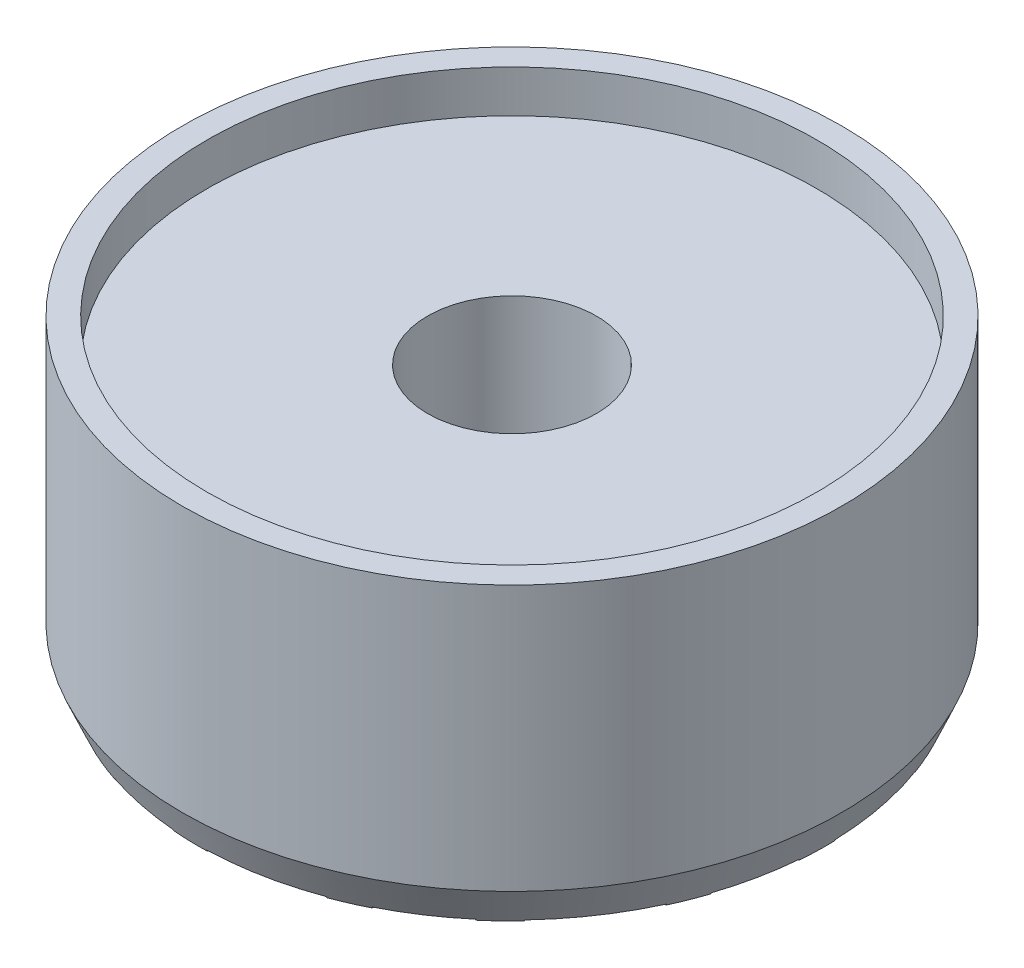
from build123d import *

# Parameters (mm, degrees)
SKETCH1_R                    = 99.06
BOSS_EXTRUDE1_DEPTH          = 88.9
SKETCH2_R                    = 25.4
CUT_EXTRUDE1_DEPTH           = 76.2
SKETCH3_R                    = 91.687559662
CUT_EXTRUDE2_DEPTH           = 12.7
CUT_EXTRUDE3_START           = 50.8
SKETCH5_R                    = 25.4
CUT_EXTRUDE3_DEPTH           = 50.8
CUT_EXTRUDE4_DEPTH           = 50.8
CUT_EXTRUDE4_DRAFT           = 3
CUT_EXTRUDE4_PROFILE_2_DEPTH = 50.8
CUT_EXTRUDE4_PROFILE_2_DRAFT = 3
CUT_EXTRUDE4_PROFILE_3_DEPTH = 50.8
CUT_EXTRUDE4_PROFILE_3_DRAFT = 3
CUT_EXTRUDE4_PROFILE_4_DEPTH = 50.8
CUT_EXTRUDE4_PROFILE_4_DRAFT = 3
CUT_EXTRUDE4_PROFILE_5_DEPTH = 50.8
CUT_EXTRUDE4_PROFILE_5_DRAFT = 3
CUT_EXTRUDE4_PROFILE_6_DEPTH = 50.8
CUT_EXTRUDE4_PROFILE_6_DRAFT = 3
CUT_EXTRUDE4_PROFILE_7_DEPTH = 50.8
CUT_EXTRUDE4_PROFILE_7_DRAFT = 3
CUT_EXTRUDE4_PROFILE_8_DEPTH = 50.8
CUT_EXTRUDE4_PROFILE_8_DRAFT = 3
CUT_EXTRUDE4_PROFILE_9_DEPTH = 50.8
CUT_EXTRUDE4_PROFILE_9_DRAFT = 3
SKETCH8_R                    = 25.4
BOSS_EXTRUDE2_DEPTH          = 30.48
SKETCH9_R                    = 22.86
CUT_EXTRUDE5_DEPTH           = 30.48
CHAMFER1_SIZE                = 9.131629152
CHAMFER1_SIZE_2              = 5.08


with BuildPart() as part:
    # Sketch1 → Boss-Extrude1 (new body)
    with BuildSketch(Plane(origin=(0, 0, 0), x_dir=(1, 0, 0), z_dir=(0, 1, 0))):
        with Locations(Location((0, 0, 0), (0, 0, 270))):
            Circle(SKETCH1_R)
    extrude(amount=BOSS_EXTRUDE1_DEPTH)

    # Sketch2 → Cut-Extrude1 (cut)
    with BuildSketch(Plane(origin=(0, 88.9, 0), x_dir=(1, 0, 0), z_dir=(0, 1, 0))):
        with Locations(Location((0, 0, 0), (0, 0, 270))):
            Circle(SKETCH2_R)
    extrude(amount=-CUT_EXTRUDE1_DEPTH, mode=Mode.SUBTRACT)

    # Sketch3 → Cut-Extrude2 (cut)
    with BuildSketch(Plane(origin=(0, 88.9, 0), x_dir=(1, 0, 0), z_dir=(0, 1, 0))):
        with Locations(Location((0, 0, 0), (0, 0, 270))):
            Circle(SKETCH3_R)
    extrude(amount=-CUT_EXTRUDE2_DEPTH, mode=Mode.SUBTRACT)

    # Sketch4 → Revolve1 (revolve)
    with BuildSketch(Plane.XY, mode=Mode.PRIVATE) as revolve1_sk:
        Polygon((0, 0), (0, -39.692768961), (99.06, 0), align=None)
    revolve(revolve1_sk.sketch.rotate(Axis((0, 0, 0), (0, -1, 0)), 90), axis=Axis((0, 0, 0), (0, -1, 0)))

    # Sketch5 → Cut-Extrude3 (cut)
    with BuildSketch(Plane(origin=(0, -52.324, 0), x_dir=(1, 0, 0), z_dir=(0, 1, 0)).offset(CUT_EXTRUDE3_START)):
        with Locations(Location((0, 0, 0), (0, 0, 270))):
            Circle(SKETCH5_R)
    extrude(amount=-CUT_EXTRUDE3_DEPTH, mode=Mode.SUBTRACT)


with BuildPart() as cut_extrude4_tool:
    # Sketch6 → Cut-Extrude4 (with draft: the straight prism first)
    with BuildSketch(Plane(origin=(0, -52.324, 0), x_dir=(1, 0, 0), z_dir=(0, 1, 0))):
        with BuildLine():
            Line((-5.08, -98.929657838), (-5.08, -24.886815787))
            Line((-5.08, -24.886815787), (-34.098749141, -93.006230474))
            ThreePointArc((-34.098749141, -93.006230474), (-19.812, -97.058581568), (-5.08, -98.929657838))
        make_face()
    extrude(amount=CUT_EXTRUDE4_DEPTH)
    # Cut-Extrude4: the draft: its side faces are tilted about the plane it starts from
    cut_extrude4_sides = [cut_extrude4_tool.faces().sort_by_distance(p)[0] for p in [
        (-5.08, -26.924, 61.908236812),
        (-19.589374571, -26.924, 58.94652313),
        (-19.812, -26.924, 97.058581568),
    ]]
    draft(cut_extrude4_sides, Plane(origin=(0, -52.324, 0), x_dir=(1, 0, 0), z_dir=(0, 1, 0)), CUT_EXTRUDE4_DRAFT)


with BuildPart() as part_1:
    add(part.part)

    # Cut-Extrude4: cut by cut_extrude4_tool
    add(cut_extrude4_tool.part, mode=Mode.SUBTRACT)


with BuildPart() as cut_extrude4_profile_2_tool:
    # Sketch6 → Cut-Extrude4 profile 2 (with draft: the straight prism first)
    with BuildSketch(Plane(origin=(0, -52.324, 0), x_dir=(1, 0, 0), z_dir=(0, 1, 0))):
        with BuildLine():
            ThreePointArc((-5.08, -24.886815787), (-2.552927635, -25.271378286), (0, -25.4))
            Line((0, -25.4), (0, -99.06))
            ThreePointArc((0, -99.06), (18.833477542, -97.2531939), (36.97992819, -91.898686123))
            Line((36.97992819, -91.898686123), (23.711541952, -58.906814361))
            Line((23.711541952, -58.906814361), (9.484616781, -23.562725745))
            ThreePointArc((9.484616781, -23.562725745), (11.804853239, -22.490118719), (14.005533756, -21.189738653))
            ThreePointArc((14.005533756, -21.189738653), (16.064370514, -19.674755399), (17.960512242, -17.960512242))
            Line((17.960512242, -17.960512242), (70.045997744, -70.045997744))
            ThreePointArc((70.045997744, -70.045997744), (82.085672582, -55.451113215), (91.13094213, -38.833426149))
            Line((91.13094213, -38.833426149), (58.42, -24.886815787))
            Line((58.42, -24.886815787), (23.368, -9.954726315))
            ThreePointArc((23.368, -9.954726315), (24.250207232, -7.55562368), (24.886815787, -5.08))
            ThreePointArc((24.886815787, -5.08), (25.271378286, -2.552927635), (25.4, 0))
            Line((25.4, 0), (99.06, 0))
            ThreePointArc((99.06, 0), (97.2531939, 18.833477542), (91.898686123, 36.97992819))
            Line((91.898686123, 36.97992819), (58.906814361, 23.711541952))
            Line((58.906814361, 23.711541952), (23.562725745, 9.484616781))
            ThreePointArc((23.562725745, 9.484616781), (22.490118719, 11.804853239), (21.189738653, 14.005533756))
            ThreePointArc((21.189738653, 14.005533756), (19.674755399, 16.064370514), (17.960512242, 17.960512242))
            Line((17.960512242, 17.960512242), (70.045997744, 70.045997744))
            ThreePointArc((70.045997744, 70.045997744), (55.451113215, 82.085672582), (38.833426149, 91.13094213))
            Line((38.833426149, 91.13094213), (24.886815787, 58.42))
            Line((24.886815787, 58.42), (9.954726315, 23.368))
            ThreePointArc((9.954726315, 23.368), (7.55562368, 24.250207232), (5.08, 24.886815787))
            ThreePointArc((5.08, 24.886815787), (2.552927635, 25.271378286), (0, 25.4))
            Line((0, 25.4), (0, 99.06))
            ThreePointArc((0, 99.06), (-18.833477542, 97.2531939), (-36.97992819, 91.898686123))
            Line((-36.97992819, 91.898686123), (-23.711541952, 58.906814361))
            Line((-23.711541952, 58.906814361), (-9.484616781, 23.562725745))
            ThreePointArc((-9.484616781, 23.562725745), (-11.804853239, 22.490118719), (-14.005533756, 21.189738653))
            ThreePointArc((-14.005533756, 21.189738653), (-16.064370514, 19.674755399), (-17.960512242, 17.960512242))
            Line((-17.960512242, 17.960512242), (-70.045997744, 70.045997744))
            ThreePointArc((-70.045997744, 70.045997744), (-82.085672582, 55.451113215), (-91.13094213, 38.833426149))
            Line((-91.13094213, 38.833426149), (-58.42, 24.886815787))
            Line((-58.42, 24.886815787), (-23.368, 9.954726315))
            ThreePointArc((-23.368, 9.954726315), (-24.250207232, 7.55562368), (-24.886815787, 5.08))
            ThreePointArc((-24.886815787, 5.08), (-25.271378286, 2.552927635), (-25.4, 0))
            Line((-25.4, 0), (-99.06, 0))
            ThreePointArc((-99.06, 0), (-97.2531939, -18.833477542), (-91.898686123, -36.97992819))
            Line((-91.898686123, -36.97992819), (-58.906814361, -23.711541952))
            Line((-58.906814361, -23.711541952), (-23.562725745, -9.484616781))
            ThreePointArc((-23.562725745, -9.484616781), (-22.490118719, -11.804853239), (-21.189738653, -14.005533756))
            ThreePointArc((-21.189738653, -14.005533756), (-19.674755399, -16.064370514), (-17.960512242, -17.960512242))
            Line((-17.960512242, -17.960512242), (-70.045997744, -70.045997744))
            ThreePointArc((-70.045997744, -70.045997744), (-55.451113215, -82.085672582), (-38.833426149, -91.13094213))
            Line((-38.833426149, -91.13094213), (-24.886815787, -58.42))
            Line((-24.886815787, -58.42), (-9.954726315, -23.368))
            ThreePointArc((-9.954726315, -23.368), (-7.55562368, -24.250207232), (-5.08, -24.886815787))
        make_face()
    extrude(amount=CUT_EXTRUDE4_PROFILE_2_DEPTH)
    # Cut-Extrude4 profile 2: the draft: its side faces are tilted about the plane it starts from
    cut_extrude4_profile_2_sides = [cut_extrude4_profile_2_tool.faces().sort_by_distance(p)[0] for p in [
        (-97.2531939, -26.924, 18.833477542),
        (-24.886815787, -26.924, -5.08),
        (-40.894, -26.924, -17.420771051),
        (-74.775471065, -26.924, -31.860120968),
        (-82.085672582, -26.924, -55.451113215),
        (-44.003254993, -26.924, -44.003254993),
        (-14.005533756, -26.924, -21.189738653),
        (-16.598079366, -26.924, -41.234770053),
        (-30.345735071, -26.924, -75.402750242),
        (-18.833477542, -26.924, -97.2531939),
        (0, -26.924, -62.23),
        (5.08, -26.924, -24.886815787),
        (17.420771051, -26.924, -40.894),
        (31.860120968, -26.924, -74.775471065),
        (55.451113215, -26.924, -82.085672582),
        (44.003254993, -26.924, -44.003254993),
        (21.189738653, -26.924, -14.005533756),
        (41.234770053, -26.924, -16.598079366),
        (75.402750242, -26.924, -30.345735071),
        (97.2531939, -26.924, -18.833477542),
        (62.23, -26.924, 0),
        (24.886815787, -26.924, 5.08),
        (40.894, -26.924, 17.420771051),
        (74.775471065, -26.924, 31.860120968),
        (82.085672582, -26.924, 55.451113215),
        (44.003254993, -26.924, 44.003254993),
        (14.005533756, -26.924, 21.189738653),
        (16.598079366, -26.924, 41.234770053),
        (30.345735071, -26.924, 75.402750242),
        (18.833477542, -26.924, 97.2531939),
        (0, -26.924, 62.23),
        (-5.08, -26.924, 24.886815787),
        (-17.420771051, -26.924, 40.894),
        (-31.860120968, -26.924, 74.775471065),
        (-55.451113215, -26.924, 82.085672582),
        (-44.003254993, -26.924, 44.003254993),
        (-21.189738653, -26.924, 14.005533756),
        (-41.234770053, -26.924, 16.598079366),
        (-75.402750242, -26.924, 30.345735071),
        (-62.23, -26.924, 0),
    ]]
    draft(cut_extrude4_profile_2_sides, Plane(origin=(0, -52.324, 0), x_dir=(1, 0, 0), z_dir=(0, 1, 0)), CUT_EXTRUDE4_PROFILE_2_DRAFT)


with BuildPart() as part_2:
    add(part_1.part)

    # Cut-Extrude4 profile 2: cut by cut_extrude4_profile_2_tool
    add(cut_extrude4_profile_2_tool.part, mode=Mode.SUBTRACT)


with BuildPart() as cut_extrude4_profile_3_tool:
    # Sketch6 → Cut-Extrude4 profile 3 (with draft: the straight prism first)
    with BuildSketch(Plane(origin=(0, -52.324, 0), x_dir=(1, 0, 0), z_dir=(0, 1, 0))):
        with BuildLine():
            Line((14.005533756, -21.189738653), (41.653879513, -89.876793009))
            ThreePointArc((41.653879513, -89.876793009), (54.62158165, -82.639980748), (66.361729469, -73.545934366))
            Line((66.361729469, -73.545934366), (14.005533756, -21.189738653))
        make_face()
    extrude(amount=CUT_EXTRUDE4_PROFILE_3_DEPTH)
    # Cut-Extrude4 profile 3: the draft: its side faces are tilted about the plane it starts from
    cut_extrude4_profile_3_sides = [cut_extrude4_profile_3_tool.faces().sort_by_distance(p)[0] for p in [
        (27.829706635, -26.924, 55.533265831),
        (54.62158165, -26.924, 82.639980748),
        (40.183631613, -26.924, 47.36783651),
    ]]
    draft(cut_extrude4_profile_3_sides, Plane(origin=(0, -52.324, 0), x_dir=(1, 0, 0), z_dir=(0, 1, 0)), CUT_EXTRUDE4_PROFILE_3_DRAFT)


with BuildPart() as part_3:
    add(part_2.part)

    # Cut-Extrude4 profile 3: cut by cut_extrude4_profile_3_tool
    add(cut_extrude4_profile_3_tool.part, mode=Mode.SUBTRACT)


with BuildPart() as cut_extrude4_profile_4_tool:
    # Sketch6 → Cut-Extrude4 profile 4 (with draft: the straight prism first)
    with BuildSketch(Plane(origin=(0, -52.324, 0), x_dir=(1, 0, 0), z_dir=(0, 1, 0))):
        with BuildLine():
            Line((24.886815787, -5.08), (93.006230474, -34.098749141))
            ThreePointArc((93.006230474, -34.098749141), (97.058581568, -19.812), (98.929657838, -5.08))
            Line((98.929657838, -5.08), (24.886815787, -5.08))
        make_face()
    extrude(amount=CUT_EXTRUDE4_PROFILE_4_DEPTH)
    # Cut-Extrude4 profile 4: the draft: its side faces are tilted about the plane it starts from
    cut_extrude4_profile_4_sides = [cut_extrude4_profile_4_tool.faces().sort_by_distance(p)[0] for p in [
        (61.908236812, -26.924, 5.08),
        (58.94652313, -26.924, 19.589374571),
        (97.058581568, -26.924, 19.812),
    ]]
    draft(cut_extrude4_profile_4_sides, Plane(origin=(0, -52.324, 0), x_dir=(1, 0, 0), z_dir=(0, 1, 0)), CUT_EXTRUDE4_PROFILE_4_DRAFT)


with BuildPart() as part_4:
    add(part_3.part)

    # Cut-Extrude4 profile 4: cut by cut_extrude4_profile_4_tool
    add(cut_extrude4_profile_4_tool.part, mode=Mode.SUBTRACT)


with BuildPart() as cut_extrude4_profile_5_tool:
    # Sketch6 → Cut-Extrude4 profile 5 (with draft: the straight prism first)
    with BuildSketch(Plane(origin=(0, -52.324, 0), x_dir=(1, 0, 0), z_dir=(0, 1, 0))):
        with BuildLine():
            Line((21.189738653, 14.005533756), (89.876793009, 41.653879513))
            ThreePointArc((89.876793009, 41.653879513), (82.639980748, 54.62158165), (73.545934366, 66.361729469))
            Line((73.545934366, 66.361729469), (21.189738653, 14.005533756))
        make_face()
    extrude(amount=CUT_EXTRUDE4_PROFILE_5_DEPTH)
    # Cut-Extrude4 profile 5: the draft: its side faces are tilted about the plane it starts from
    cut_extrude4_profile_5_sides = [cut_extrude4_profile_5_tool.faces().sort_by_distance(p)[0] for p in [
        (55.533265831, -26.924, -27.829706635),
        (82.639980748, -26.924, -54.62158165),
        (47.36783651, -26.924, -40.183631613),
    ]]
    draft(cut_extrude4_profile_5_sides, Plane(origin=(0, -52.324, 0), x_dir=(1, 0, 0), z_dir=(0, 1, 0)), CUT_EXTRUDE4_PROFILE_5_DRAFT)


with BuildPart() as part_5:
    add(part_4.part)

    # Cut-Extrude4 profile 5: cut by cut_extrude4_profile_5_tool
    add(cut_extrude4_profile_5_tool.part, mode=Mode.SUBTRACT)


with BuildPart() as cut_extrude4_profile_6_tool:
    # Sketch6 → Cut-Extrude4 profile 6 (with draft: the straight prism first)
    with BuildSketch(Plane(origin=(0, -52.324, 0), x_dir=(1, 0, 0), z_dir=(0, 1, 0))):
        with BuildLine():
            Line((5.08, 24.886815787), (34.098749141, 93.006230474))
            ThreePointArc((34.098749141, 93.006230474), (19.812, 97.058581568), (5.08, 98.929657838))
            Line((5.08, 98.929657838), (5.08, 24.886815787))
        make_face()
    extrude(amount=CUT_EXTRUDE4_PROFILE_6_DEPTH)
    # Cut-Extrude4 profile 6: the draft: its side faces are tilted about the plane it starts from
    cut_extrude4_profile_6_sides = [cut_extrude4_profile_6_tool.faces().sort_by_distance(p)[0] for p in [
        (5.08, -26.924, -61.908236812),
        (19.589374571, -26.924, -58.94652313),
        (19.812, -26.924, -97.058581568),
    ]]
    draft(cut_extrude4_profile_6_sides, Plane(origin=(0, -52.324, 0), x_dir=(1, 0, 0), z_dir=(0, 1, 0)), CUT_EXTRUDE4_PROFILE_6_DRAFT)


with BuildPart() as part_6:
    add(part_5.part)

    # Cut-Extrude4 profile 6: cut by cut_extrude4_profile_6_tool
    add(cut_extrude4_profile_6_tool.part, mode=Mode.SUBTRACT)


with BuildPart() as cut_extrude4_profile_7_tool:
    # Sketch6 → Cut-Extrude4 profile 7 (with draft: the straight prism first)
    with BuildSketch(Plane(origin=(0, -52.324, 0), x_dir=(1, 0, 0), z_dir=(0, 1, 0))):
        with BuildLine():
            ThreePointArc((-41.653879513, 89.876793009), (-54.62158165, 82.639980748), (-66.361729469, 73.545934366))
            Line((-66.361729469, 73.545934366), (-14.005533756, 21.189738653))
            Line((-14.005533756, 21.189738653), (-41.653879513, 89.876793009))
        make_face()
    extrude(amount=CUT_EXTRUDE4_PROFILE_7_DEPTH)
    # Cut-Extrude4 profile 7: the draft: its side faces are tilted about the plane it starts from
    cut_extrude4_profile_7_sides = [cut_extrude4_profile_7_tool.faces().sort_by_distance(p)[0] for p in [
        (-54.62158165, -26.924, -82.639980748),
        (-40.183631613, -26.924, -47.36783651),
        (-27.829706635, -26.924, -55.533265831),
    ]]
    draft(cut_extrude4_profile_7_sides, Plane(origin=(0, -52.324, 0), x_dir=(1, 0, 0), z_dir=(0, 1, 0)), CUT_EXTRUDE4_PROFILE_7_DRAFT)


with BuildPart() as part_7:
    add(part_6.part)

    # Cut-Extrude4 profile 7: cut by cut_extrude4_profile_7_tool
    add(cut_extrude4_profile_7_tool.part, mode=Mode.SUBTRACT)


with BuildPart() as cut_extrude4_profile_8_tool:
    # Sketch6 → Cut-Extrude4 profile 8 (with draft: the straight prism first)
    with BuildSketch(Plane(origin=(0, -52.324, 0), x_dir=(1, 0, 0), z_dir=(0, 1, 0))):
        with BuildLine():
            ThreePointArc((-93.006230474, 34.098749141), (-97.058581568, 19.812), (-98.929657838, 5.08))
            Line((-98.929657838, 5.08), (-24.886815787, 5.08))
            Line((-24.886815787, 5.08), (-93.006230474, 34.098749141))
        make_face()
    extrude(amount=CUT_EXTRUDE4_PROFILE_8_DEPTH)
    # Cut-Extrude4 profile 8: the draft: its side faces are tilted about the plane it starts from
    cut_extrude4_profile_8_sides = [cut_extrude4_profile_8_tool.faces().sort_by_distance(p)[0] for p in [
        (-97.058581568, -26.924, -19.812),
        (-61.908236812, -26.924, -5.08),
        (-58.94652313, -26.924, -19.589374571),
    ]]
    draft(cut_extrude4_profile_8_sides, Plane(origin=(0, -52.324, 0), x_dir=(1, 0, 0), z_dir=(0, 1, 0)), CUT_EXTRUDE4_PROFILE_8_DRAFT)


with BuildPart() as part_8:
    add(part_7.part)

    # Cut-Extrude4 profile 8: cut by cut_extrude4_profile_8_tool
    add(cut_extrude4_profile_8_tool.part, mode=Mode.SUBTRACT)


with BuildPart() as cut_extrude4_profile_9_tool:
    # Sketch6 → Cut-Extrude4 profile 9 (with draft: the straight prism first)
    with BuildSketch(Plane(origin=(0, -52.324, 0), x_dir=(1, 0, 0), z_dir=(0, 1, 0))):
        with BuildLine():
            ThreePointArc((-89.876793009, -41.653879513), (-82.639980748, -54.62158165), (-73.545934366, -66.361729469))
            Line((-73.545934366, -66.361729469), (-21.189738653, -14.005533756))
            Line((-21.189738653, -14.005533756), (-89.876793009, -41.653879513))
        make_face()
    extrude(amount=CUT_EXTRUDE4_PROFILE_9_DEPTH)
    # Cut-Extrude4 profile 9: the draft: its side faces are tilted about the plane it starts from
    cut_extrude4_profile_9_sides = [cut_extrude4_profile_9_tool.faces().sort_by_distance(p)[0] for p in [
        (-82.639980748, -26.924, 54.62158165),
        (-47.36783651, -26.924, 40.183631613),
        (-55.533265831, -26.924, 27.829706635),
    ]]
    draft(cut_extrude4_profile_9_sides, Plane(origin=(0, -52.324, 0), x_dir=(1, 0, 0), z_dir=(0, 1, 0)), CUT_EXTRUDE4_PROFILE_9_DRAFT)


with BuildPart() as part_9:
    add(part_8.part)

    # Cut-Extrude4 profile 9: cut by cut_extrude4_profile_9_tool
    add(cut_extrude4_profile_9_tool.part, mode=Mode.SUBTRACT)

    # Sketch8 → Boss-Extrude2 (add)
    with BuildSketch(Plane(origin=(0, 0, 0), x_dir=(1, 0, 0), z_dir=(0, 1, 0))):
        with Locations(Location((0, 0, 0), (0, 0, 270))):
            Circle(SKETCH8_R)
    extrude(amount=-BOSS_EXTRUDE2_DEPTH)

    # Sketch9 → Cut-Extrude5 (cut)
    with BuildSketch(Plane(origin=(0, 0, 0), x_dir=(1, 0, 0), z_dir=(0, 1, 0))):
        with Locations(Location((0, 0, 0), (0, 0, 270))):
            Circle(SKETCH9_R)
    extrude(amount=-CUT_EXTRUDE5_DEPTH, mode=Mode.SUBTRACT)

    # Chamfer1
    # the kernel refuses this chamfer: 9.131629152, 5.08 mm, written as the material it takes off along each edge
    with BuildSketch(Plane(origin=(0, 0, 0), x_dir=(0, 0, 1), z_dir=(-1, 0, 0))) as chamfer1_piece_1:
        Polygon((99.06, CHAMFER1_SIZE), (99.06 - CHAMFER1_SIZE_2 * 0.92825431494, -CHAMFER1_SIZE_2 * 0.371946134266), (99.06, 0), align=None)
    revolve(axis=Axis((0, 0, 0), (0, 1, 0)), mode=Mode.SUBTRACT)


solid = part_9.part
